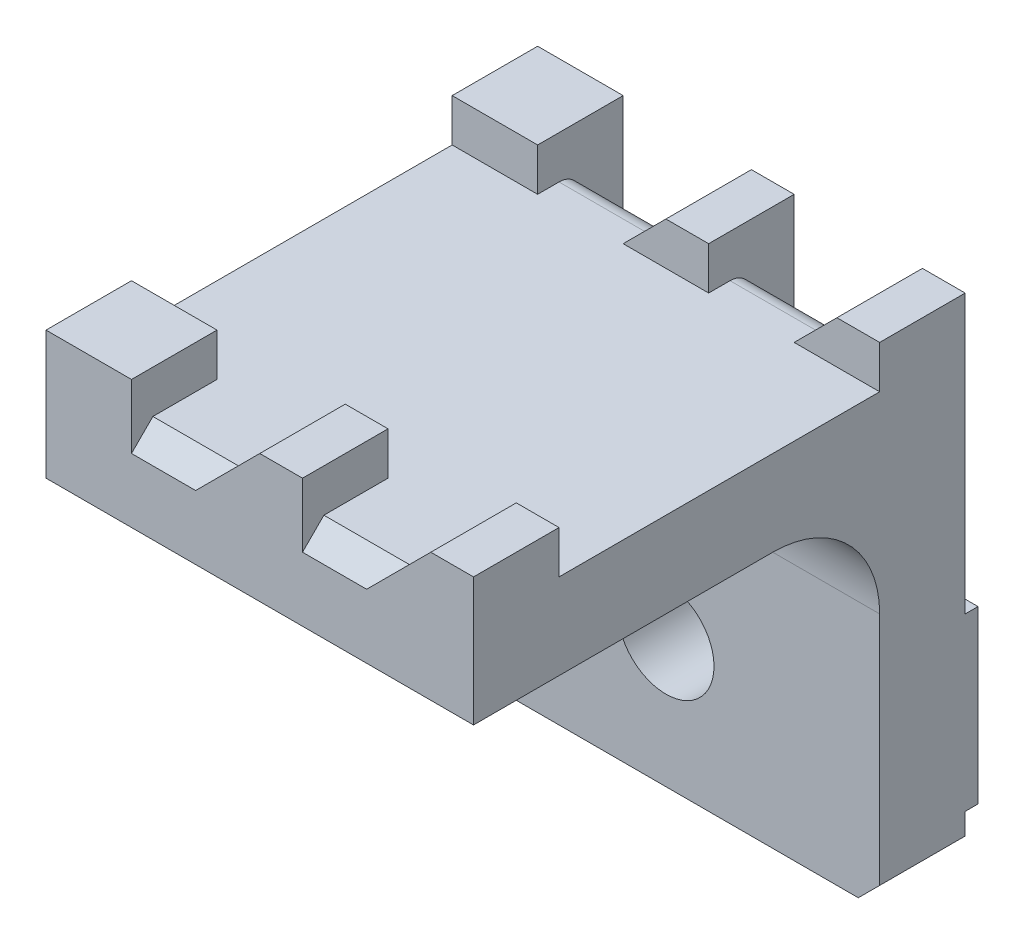
from build123d import *

# Parameters (mm, degrees)
BOSS_EXTRUDE1_DEPTH  = 10
SKETCH2_R            = 2.25
CUT_EXTRUDE1_DEPTH   = 31.033314835
CHAMFER4_SIZE        = 1
FILLET1_R            = 5
CUT_EXTRUDE2_START   = 4
SKETCH3_W            = 4
SKETCH3_H            = 2
CUT_EXTRUDE2_DEPTH   = 2
FILLET2_R            = 1
FILLET2_OF_MIRROR1_R = 1
CHAMFER5_SIZE        = 2
CHAMFER6_START       = -6
CHAMFER6_DEPTH       = 4
CHAMFER6_START_2     = 2
CHAMFER6_2_DEPTH     = 4
CHAMFER6_START_3     = -1.414213562
CHAMFER6_3_DEPTH     = 2.828427124
CHAMFER6_START_4     = 4.242640687
CHAMFER6_4_DEPTH     = 1.757359313


with BuildPart() as part:
    # Sketch1 → Boss-Extrude1 (new, symmetric)
    with BuildSketch(Plane(origin=(0, 0, 0), x_dir=(0, 0, -1), z_dir=(1, 0, 0))):
        Polygon((7.5, 2), (11.5, 2), (11.5, -11), (12.1, -11), (12.1, -19), (11.5, -19), (11.5, -21), (7.5, -21), (7.5, -4), (-11.5, -4), (-11.5, 2), (-7.5, 2), (-7.5, 0), (7.5, 0), align=None)
    extrude(amount=BOSS_EXTRUDE1_DEPTH, both=True)

    # Sketch2 → Cut-Extrude1 (cut, through all)
    with BuildSketch(Plane.XY.offset(-7.5)):
        with Locations((0, -15)):
            Circle(SKETCH2_R)
    extrude(amount=-CUT_EXTRUDE1_DEPTH, mode=Mode.SUBTRACT)

    # Chamfer4
    chamfer4_edges = [part.edges().sort_by_distance(p)[0] for p in [
        (-10, -21, -9.5),
        (10, -21, -9.5),
    ]]
    chamfer(chamfer4_edges, length=CHAMFER4_SIZE)

    # Fillet1
    fillet1_edges = [part.edges().sort_by_distance(p)[0] for p in [
        (0, -4, -7.5),
    ]]
    fillet(fillet1_edges, radius=FILLET1_R)

    # Sketch3 → Cut-Extrude2 (cut, symmetric)
    with BuildSketch(Plane(origin=(0, 0, 0), x_dir=(0, 0, -1), z_dir=(1, 0, 0)).offset(CUT_EXTRUDE2_START)):
        with BuildLine():
            Line((2.5, -4), (6.5, -4))
            ThreePointArc((6.5, -4), (8.621320344, -3.121320344), (9.5, -1))
            Line((9.5, -1), (9.5, 0))
            Line((9.5, 0), (7.5, 0))
            Line((7.5, 0), (7.5, 2))
            Line((7.5, 2), (11.5, 2))
            Line((11.5, 2), (11.5, -1))
            Line((11.5, -1), (11.5, -3.763932023))
            ThreePointArc((11.5, -3.763932023), (9.724744871, -6.50254481), (6.5, -6))
            Line((6.5, -6), (2.5, -4))
        make_face()
        with Locations((-9.5, 1)):
            Rectangle(SKETCH3_W, SKETCH3_H)
    cut_extrude2 = extrude(amount=CUT_EXTRUDE2_DEPTH, both=True, mode=Mode.SUBTRACT)

    # Fillet2
    fillet2_edges = [part.edges().sort_by_distance(p)[0] for p in [
        (4, 0, -9.5),
    ]]
    fillet(fillet2_edges, radius=FILLET2_R - 0.0001)  # a hair under: the kernel refuses the full size

    # Mirror1: Cut-Extrude2 across plane
    add(cut_extrude2.mirror(Plane(origin=(0, 0, 0), x_dir=(0, 0, 1), z_dir=(1, 0, 0))), mode=Mode.SUBTRACT)

    # Fillet2 of Mirror1
    fillet2_of_mirror1_edges = [part.edges().sort_by_distance(p)[0] for p in [
        (-4, 0, -9.5),
    ]]
    fillet(fillet2_of_mirror1_edges, radius=FILLET2_OF_MIRROR1_R - 0.0001)  # a hair under: the kernel refuses the full size

    # Chamfer5
    chamfer5_edges = [part.edges().sort_by_distance(p)[0] for p in [
        (6, 2, 9.5),
        (6, 2, -9.5),
        (-2, 2, -9.5),
        (-2, 2, 9.5),
    ]]
    chamfer(chamfer5_edges, length=CHAMFER5_SIZE - 0.0001)  # a hair under: the kernel refuses the full size

    # Chamfer6: read off the stored shape, not the designer's step
    # Chamfer6 outline → Chamfer6 (cut)
    with BuildSketch(Plane.YZ.offset(CHAMFER6_START)):
        Polygon((0, 11.5), (-1, 11.5), (0, 10.5), align=None)
    extrude(amount=CHAMFER6_DEPTH, mode=Mode.SUBTRACT)

    # Chamfer6 2 outline → Chamfer6 2 (cut)
    with BuildSketch(Plane.YZ.offset(CHAMFER6_START_2)):
        Polygon((0, 11.5), (-1, 11.5), (0, 10.5), align=None)
    extrude(amount=CHAMFER6_2_DEPTH, mode=Mode.SUBTRACT)

    # Chamfer6 3 outline → Chamfer6 3 (add)
    with BuildSketch(Plane(origin=(0, 0, 0), x_dir=(0.7071067811865471, 0.707106781186548, 0), z_dir=(0.707106781186548, -0.707106781186547, 0)).offset(CHAMFER6_START_3)):
        Polygon((-1.414213562, 7.5), (1.414213562, 7.5), (1.414213562, 11.5), (-2.828427125, 11.5), (-1.414213562, 10.5), align=None)
    extrude(amount=CHAMFER6_3_DEPTH)

    # Chamfer6 4 outline → Chamfer6 4 (add)
    with BuildSketch(Plane(origin=(0, 0, 0), x_dir=(0.7071067811865471, 0.707106781186548, 0), z_dir=(0.707106781186548, -0.707106781186547, 0)).offset(CHAMFER6_START_4)):
        Polygon((4.242640687, 7.5), (7.071067812, 7.5), (7.071067812, 11.5), (2.828427125, 11.5), (4.242640687, 10.5), align=None)
    extrude(amount=CHAMFER6_4_DEPTH)


solid = part.part
